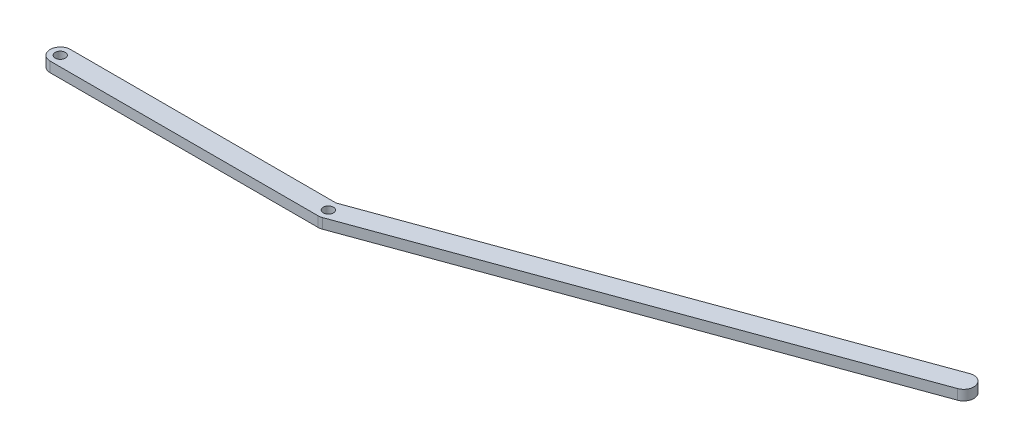
from build123d import *

# Parameters (mm, degrees)
SKETCH1_R           = 5
BOSS_EXTRUDE1_DEPTH = 5
SKETCH2_R           = 5
BOSS_EXTRUDE2_DEPTH = 5


with BuildPart() as part:
    # Sketch1 → Boss-Extrude1 (new, symmetric)
    with BuildSketch(Plane(origin=(0, 0, 0), x_dir=(1, 0, 0), z_dir=(0, 1, 0))):
        with BuildLine():
            Line((-2.224544129, 9.832109877), (-265, 10))
            ThreePointArc((-265, 10), (-275, 0), (-265, -10))
            Line((-265, -10), (0, -10))
            ThreePointArc((0, -10), (1.736481777, -9.84807753), (3.420201433, -9.396926208))
            Line((3.420201433, -9.396926208), (463.869585618, 158.192944022))
            ThreePointArc((463.869585618, 158.192944022), (469.846310393, 171.010071663), (457.029182752, 176.986796437))
            Line((457.029182752, 176.986796437), (-2.224544129, 9.832109877))
        make_face()
        with Locations((-265, 0)):
            Circle(SKETCH1_R, mode=Mode.SUBTRACT)
        Circle(SKETCH1_R, mode=Mode.SUBTRACT)
        with Locations((460.449384185, 167.58987023)):
            Circle(SKETCH1_R, mode=Mode.SUBTRACT)
    extrude(amount=BOSS_EXTRUDE1_DEPTH, both=True)

    # Sketch2 → Boss-Extrude2 (add, symmetric)
    with BuildSketch(Plane(origin=(0, 0, 0), x_dir=(1, 0, 0), z_dir=(0, 1, 0))):
        with Locations((460.449384185, 167.58987023)):
            Circle(SKETCH2_R)
    extrude(amount=BOSS_EXTRUDE2_DEPTH, both=True)


solid = part.part
